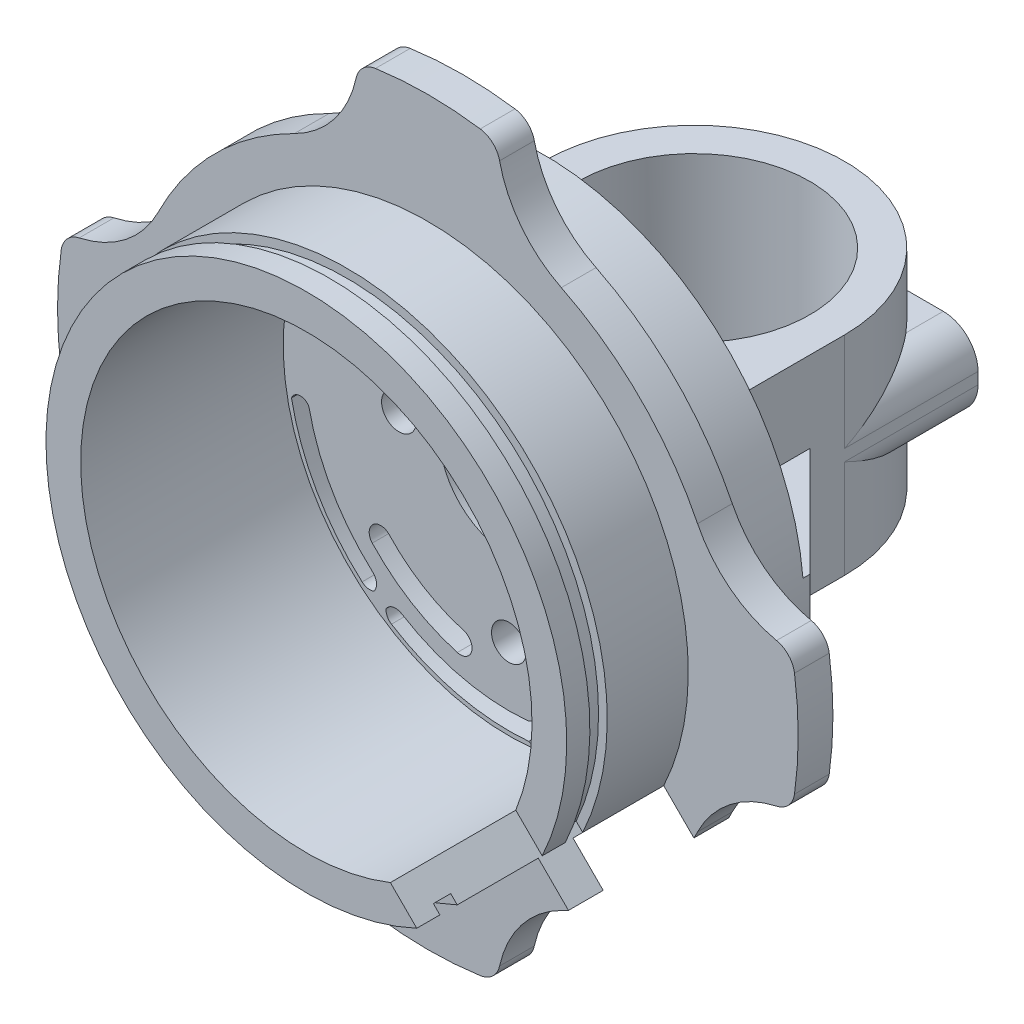
from build123d import *

# Parameters (mm, degrees)
SKETCH_1_R           = 18
EXTRUDE_1_DEPTH      = 3
SKETCH_2_W           = 26
SKETCH_2_H           = 18
EXTRUDE_2_DEPTH      = 13
EXTRUDE_3_DEPTH      = 9
SKETCH_6_R           = 10
CUT_EXTRUDE_1_DEPTH  = 42.581245773
SKETCH_7_R           = 1.5
CUT_EXTRUDE_2_DEPTH  = 39.587562763
EXTRUDE_4_DEPTH      = 3.5
SKETCH_9_R           = 1.5
CUT_EXTRUDE_3_DEPTH  = 38.497226678
FILLET_1_R           = 3
SKETCH_10_R          = 6
CUT_EXTRUDE_4_DEPTH  = 10
EXTRUDE_START        = -3
SKETCH_12_R          = 26
SKETCH_12_R_2        = 18
EXTRUDE_5_DEPTH      = 3
SKETCH_13_R          = 22.5
SKETCH_13_R_2        = 19.5
EXTRUDE_6_DEPTH      = 17.5
CUT_EXTRUDE_START    = -1.5
SKETCH_21_R          = 22.5
SKETCH_21_R_2        = 21.75
CUT_EXTRUDE_7_DEPTH  = 1.5
CUT_EXTRUDE_8_REACH  = 61.281
CUT_EXTRUDE_11_DEPTH = 3
SKETCH_28_W          = 10
SKETCH_28_H          = 4
EXTRUDE_10_DEPTH     = 10
CUT_EXTRUDE_13_DEPTH = 10
CUT_EXTRUDE_16_DEPTH = 10
CUT_EXTRUDE_17_DEPTH = 10
FILLET_4_R           = 1
FILLET_5_R           = 1
FILLET_6_R           = 1
FILLET_7_R           = 1
CUT_EXTRUDE_START_2  = -10
SKETCH_35_R          = 26
SKETCH_35_R_2        = 22.5
CUT_EXTRUDE_18_DEPTH = 10
SKETCH_36_R          = 26
SKETCH_36_R_2        = 22.5
EXTRUDE_11_DEPTH     = 3
CUT_EXTRUDE_19_DEPTH = 3
EXTRUDE_12_DEPTH     = 3
FILLET_8_R           = 10
FILLET_9_R           = 2
EXTRUDE_13_DEPTH     = 3
FILLET_10_R          = 10
FILLET_11_R          = 2


with BuildPart() as part:
    # 草图1 → 凸台-拉伸1 (new body)
    with BuildSketch(Plane.XY):
        Circle(SKETCH_1_R)
    extrude(amount=EXTRUDE_1_DEPTH)

    # 草图2 → 凸台-拉伸2 (add)
    with BuildSketch(Plane(origin=(0, 0, 0), x_dir=(-1, 0, 0), z_dir=(0, 0, -1))):
        Rectangle(SKETCH_2_W, SKETCH_2_H)
    extrude(amount=EXTRUDE_2_DEPTH)

    # 草图5 → 凸台-拉伸3 (add, symmetric)
    with BuildSketch(Plane(origin=(0, 0, 0), x_dir=(1, 0, 0), z_dir=(0, 1, 0))):
        with BuildLine():
            Line((-13, 13), (13, 13))
            ThreePointArc((13, 13), (0, 26), (-13, 13))
        make_face()
    extrude(amount=EXTRUDE_3_DEPTH, both=True)

    # 草图6 → 切除-拉伸1 (cut, through all)
    with BuildSketch(Plane(origin=(0, 9, 0), x_dir=(1, 0, 0), z_dir=(0, 1, 0))):
        with Locations(Location((0, 13, 0), (0, 0, 180))):
            Circle(SKETCH_6_R)
    extrude(amount=-CUT_EXTRUDE_1_DEPTH, mode=Mode.SUBTRACT)

    # 草图7 → 切除-拉伸2 (cut, through all)
    with BuildSketch(Plane.XY.offset(3)):
        with Locations((-9.5, 0)):
            Circle(SKETCH_7_R)
        with Locations((9.5, 0)):
            Circle(SKETCH_7_R)
        with Locations((0, 12.5)):
            Circle(SKETCH_7_R)
        with Locations((0, -12.5)):
            Circle(SKETCH_7_R)
    extrude(amount=-CUT_EXTRUDE_2_DEPTH, mode=Mode.SUBTRACT)

    # 草图8 → 凸台-拉伸4 (add, symmetric)
    with BuildSketch(Plane(origin=(0, 0, 0), x_dir=(1, 0, 0), z_dir=(0, 1, 0))):
        with BuildLine():
            Line((-6, 24.532562595), (-13, 24.532562595))
            Line((-13, 24.532562595), (-13, 13))
            ThreePointArc((-13, 13), (-11.113055385, 19.745368782), (-6, 24.532562595))
        make_face()
        with BuildLine():
            Line((6, 24.532562595), (13, 24.532562595))
            Line((13, 24.532562595), (13, 13))
            ThreePointArc((13, 13), (11.113055385, 19.745368782), (6, 24.532562595))
        make_face()
    extrude(amount=EXTRUDE_4_DEPTH, both=True)

    # 草图9 → 切除-拉伸3 (cut, through all)
    with BuildSketch(Plane(origin=(0, 0, -24.532562595), x_dir=(-1, 0, 0), z_dir=(0, 0, -1))):
        with Locations(Location((9.5, 0, 0), (0, 0, 180))):
            Circle(SKETCH_9_R)
        with Locations((-9.5, 0)):
            Circle(SKETCH_9_R)
    extrude(amount=-CUT_EXTRUDE_3_DEPTH, mode=Mode.SUBTRACT)

    # 圆角1
    fillet_1_edges = [part.edges().sort_by_distance(p)[0] for p in [
        (-13, -3.5, -18.766281297),
        (-13, 3.5, -18.766281297),
        (13, -3.5, -18.766281297),
        (13, 3.5, -18.766281297),
    ]]
    fillet(fillet_1_edges, radius=FILLET_1_R)

    # 草图10 → 切除-拉伸4 (cut)
    with BuildSketch(Plane.XY.offset(3)):
        Circle(SKETCH_10_R)
    extrude(amount=-CUT_EXTRUDE_4_DEPTH, mode=Mode.SUBTRACT)

    # 草图12 → 凸台-拉伸5 (add)
    with BuildSketch(Plane.XY.offset(3).offset(EXTRUDE_START)):
        Circle(SKETCH_12_R)
        Circle(SKETCH_12_R_2, mode=Mode.SUBTRACT)
    extrude(amount=EXTRUDE_5_DEPTH)

    # 草图13 → 凸台-拉伸6 (add)
    with BuildSketch(Plane.XY.offset(3)):
        Circle(SKETCH_13_R)
        Circle(SKETCH_13_R_2, mode=Mode.SUBTRACT)
    extrude(amount=EXTRUDE_6_DEPTH)

    # 草图21 → 切除-拉伸7 (cut)
    with BuildSketch(Plane.XY.offset(18.5).offset(CUT_EXTRUDE_START)):
        Circle(SKETCH_21_R)
        Circle(SKETCH_21_R_2, mode=Mode.SUBTRACT)
    extrude(amount=CUT_EXTRUDE_7_DEPTH, mode=Mode.SUBTRACT)

    # 切除-拉伸8: up to this face of the body (flat: up to its plane)
    cut_extrude_8_end = Plane(part.part.faces().sort_by_distance((-25.264608948, 0, 3))[0])
    # 草图22 → 切除-拉伸8 (cut, up to the picked face)
    with BuildSketch(Plane.XY.offset(20.5), mode=Mode.PRIVATE) as cut_extrude_8_sk1:
        Polygon((10.837782175, 0), (0, -10.837782175), (13.87016041, -24.707942585), (24.707942585, -13.87016041), align=None)
    cut_extrude_8_tool1 = split(extrude(cut_extrude_8_sk1.sketch, amount=-CUT_EXTRUDE_8_REACH, mode=Mode.PRIVATE), bisect_by=cut_extrude_8_end, keep=Keep.BOTH, mode=Mode.PRIVATE)
    add(cut_extrude_8_tool1.solids().sort_by(Axis((12.353971, -12.353971, 20.5), (0, 0, -1)))[0], mode=Mode.SUBTRACT)

    # 草图25 → 切除-拉伸11 (cut)
    with BuildSketch(Plane.XY.offset(3)):
        Polygon((7.260250026, -18.098032201), (5.581108912, -16.418891088), (13, -9), (16.418891088, -5.581108912), (18.098032201, -7.260250026), (25.296219368, -14.458437193), (14.458437193, -25.296219368), align=None)
    extrude(amount=-CUT_EXTRUDE_11_DEPTH, mode=Mode.SUBTRACT)

    # 草图28 → 凸台-拉伸10 (add)
    with BuildSketch(Plane(origin=(13, 0, 0), x_dir=(0, 0, -1), z_dir=(1, 0, 0))):
        with Locations((5, 0)):
            Rectangle(SKETCH_28_W, SKETCH_28_H)
    extrude_10 = extrude(amount=EXTRUDE_10_DEPTH)

    # 草图29 → 切除-拉伸13 (cut)
    with BuildSketch(Plane(origin=(0, 2, 0), x_dir=(1, 0, 0), z_dir=(0, 1, 0))):
        Polygon((13, 10), (23, 0), (23, 10), align=None)
    cut_extrude_13 = extrude(amount=-CUT_EXTRUDE_13_DEPTH, mode=Mode.SUBTRACT)

    # 镜向1: 凸台-拉伸10, 切除-拉伸13 across plane
    add(extrude_10.mirror(Plane(origin=(0, 0, 0), x_dir=(0, 0, 1), z_dir=(1, 0, 0))))
    add(cut_extrude_13.mirror(Plane(origin=(0, 0, 0), x_dir=(0, 0, 1), z_dir=(1, 0, 0))), mode=Mode.SUBTRACT)

    # 草图32 → 切除-拉伸16 (cut)
    with BuildSketch(Plane.XY.offset(3)):
        with BuildLine():
            Line((-1.25, 18.989775966), (-1.25, 17.486251029))
            ThreePointArc((-1.25, 17.486251029), (-11.274787606, 13.42425564), (-17.007444047, 4.251861012))
            ThreePointArc((-17.007444047, 4.251861012), (-18.038220453, 3.221084605), (-18.462657797, 4.615664449))
            ThreePointArc((-18.462657797, 4.615664449), (-12.198401118, 14.60729617), (-1.25, 18.989775966))
        make_face()
        with BuildLine():
            Line((1.25, 18.989775966), (1.25, 17.486251029))
            ThreePointArc((1.25, 17.486251029), (11.274787606, 13.42425564), (17.007444047, 4.251861012))
            ThreePointArc((17.007444047, 4.251861012), (17.607920176, 3.225791698), (18.646879703, 3.803678295))
            ThreePointArc((18.646879703, 3.803678295), (12.515024814, 14.33695383), (1.25, 18.989775966))
        make_face()
        with BuildLine():
            Line((-1.25, 16.097976574), (-1.25, 14.70939845))
            ThreePointArc((-1.25, 14.70939845), (-6.77507873, 13.115914416), (-11.272195471, 9.532392775))
            ThreePointArc((-11.272195471, 9.532392775), (-12.24744081, 9.450836993), (-12.328996592, 10.426082332))
            ThreePointArc((-12.328996592, 10.426082332), (-7.357980918, 14.372455134), (-1.25, 16.097976574))
        make_face()
        with BuildLine():
            Line((1.25, 16.097976574), (1.25, 14.70939845))
            ThreePointArc((1.25, 14.70939845), (6.77507873, 13.115914416), (11.272195471, 9.532392775))
            ThreePointArc((11.272195471, 9.532392775), (12.24744081, 9.450836993), (12.328996592, 10.426082332))
            ThreePointArc((12.328996592, 10.426082332), (7.357980918, 14.372455134), (1.25, 16.097976574))
        make_face()
    extrude(amount=-CUT_EXTRUDE_16_DEPTH, mode=Mode.SUBTRACT)

    # 草图33 → 切除-拉伸17 (cut)
    with BuildSketch(Plane.XY.offset(3)):
        with BuildLine():
            Line((-11.98073249, -14.910579423), (-11.041192675, -13.741278377))
            ThreePointArc((-11.041192675, -13.741278377), (-15.049297178, -9.178742918), (-17.271151749, -3.526752667))
            ThreePointArc((-17.271151749, -3.526752667), (-18.052998243, -3.069370633), (-18.785224063, -3.602594427))
            ThreePointArc((-18.785224063, -3.602594427), (-16.389132125, -9.862032138), (-11.98073249, -14.910579423))
        make_face()
        with BuildLine():
            Line((-10.911438585, -15.709991652), (-10.05575376, -14.47799998))
            ThreePointArc((-10.05575376, -14.47799998), (-4.443733677, -17.058250148), (1.713901598, -17.544036264))
            ThreePointArc((1.713901598, -17.544036264), (3.12617653, -18.28801874), (1.723398633, -19.049756609))
            ThreePointArc((1.723398633, -19.049756609), (-4.888100555, -18.492425549), (-10.911438585, -15.709991652))
        make_face()
        with BuildLine():
            ThreePointArc((-11.80268205, -10.978090683), (-8.437176399, -13.734476074), (-4.457143503, -15.490501942))
            ThreePointArc((-4.457143503, -15.490501942), (-3.219618835, -14.80600746), (-3.904113317, -13.568482792))
            ThreePointArc((-3.904113317, -13.568482792), (-7.390314608, -12.030339815), (-10.338237514, -9.615959191))
            ThreePointArc((-10.338237514, -9.615959191), (-11.751525528, -9.564802669), (-11.80268205, -10.978090683))
        make_face()
    extrude(amount=-CUT_EXTRUDE_17_DEPTH, mode=Mode.SUBTRACT)

    # 圆角4
    fillet_4_edges = [part.edges().sort_by_distance(p)[0] for p in [
        (-1.25, 17.486251029, 1.5),
        (1.25, 14.70939845, 1.5),
        (-1.25, 14.70939845, 1.5),
        (1.25, 17.486251029, 1.5),
        (-10.05575376, -14.47799998, 1.5),
        (-11.041192675, -13.741278377, 1.5),
    ]]
    fillet(fillet_4_edges, radius=FILLET_4_R)

    # 圆角5
    # the kernel refuses this fillet: 1 mm, written as the material it adds along each edge
    with BuildSketch(Plane(origin=(-1.25, 18.989775966, 3), x_dir=(0, -1, 0), z_dir=(0, 0, -1))) as fillet_5_piece_1:
        with BuildLine():
            CenterArc((1.08428672, 0.872687448), FILLET_5_R, 173.239166307, 67.533289918)
            Line((0.091240506, 0.990412616), (0.071379581, 0.99276712))
            ThreePointArc((0.071379581, 0.99276712), (0.019233264, 0.497637176), (-0.019956811, 0.001313655))
            Line((-0.019956811, 0.001313655), (0, -0.02))
            ThreePointArc((0, -0.02), (0.298003739, -0.02), (0.586241893, -0.017453749))
            Line((0.586241893, -0.017453749), (0.596007478, 0))
        make_face()
    extrude(amount=3)
    with BuildSketch(Plane(origin=(1.25, 18.989775966, 3), x_dir=(0, -1, 0), z_dir=(0, 0, -1))) as fillet_5_piece_2:
        with BuildLine():
            CenterArc((1.08428672, -0.872687448), FILLET_5_R, 119.227543774, 67.533289918)
            Line((0.091240506, -0.990412616), (0.071379581, -0.99276712))
            ThreePointArc((0.071379581, -0.99276712), (0.019233264, -0.497637176), (-0.019956811, -0.001313655))
            Line((-0.019956811, -0.001313655), (0, 0.02))
            ThreePointArc((0, 0.02), (0.298003739, 0.02), (0.586241893, 0.017453749))
            Line((0.586241893, 0.017453749), (0.596007478, 0))
        make_face()
    extrude(amount=3)
    with BuildSketch(Plane(origin=(1.25, 16.097976574, 3), x_dir=(1.2201884497529917e-12, -1.0, 0), z_dir=(0, 0, -1))) as fillet_5_piece_3:
        with BuildLine():
            CenterArc((1.091472558, -0.804097816), FILLET_5_R, 126.476783843, 61.317453805)
            Line((0.100711074, -0.939713746), (0.080895844, -0.942426065))
            ThreePointArc((0.080895844, -0.942426065), (0.02359244, -0.47272513), (-0.019939977, -0.001548329))
            Line((-0.019939977, -0.001548329), (0, 0.02))
            ThreePointArc((0, 0.02), (0.248487771, 0.02), (0.485085602, 0.016081956))
            Line((0.485085602, 0.016081956), (0.496975542, 0))
        make_face()
    extrude(amount=3)
    with BuildSketch(Plane(origin=(-1.25, 16.097976574, 3), x_dir=(-1.226443535178309e-12, -1.0, 0), z_dir=(0, 0, -1))) as fillet_5_piece_4:
        with BuildLine():
            CenterArc((1.091472558, 0.804097816), FILLET_5_R, 172.205762352, 61.317453805)
            Line((0.100711074, 0.939713746), (0.080895844, 0.942426065))
            ThreePointArc((0.080895844, 0.942426065), (0.02359244, 0.47272513), (-0.019939977, 0.001548329))
            Line((-0.019939977, 0.001548329), (0, -0.02))
            ThreePointArc((0, -0.02), (0.248487771, -0.02), (0.485085602, -0.016081956))
            Line((0.485085602, -0.016081956), (0.496975542, 0))
        make_face()
    extrude(amount=3)
    with BuildSketch(Plane(origin=(-10.911438585, -15.709991652, 3), x_dir=(0.570456550316079, 0.8213277812186063, 0), z_dir=(0, 0, -1))) as fillet_5_piece_5:
        with BuildLine():
            CenterArc((1.020863196, 0.869460839), FILLET_5_R, 177.250839457, 63.145206385)
            Line((0.022014106, 0.917424333), (0.002037125, 0.918383603))
            ThreePointArc((0.002037125, 0.918383603), (-0.014489926, 0.459323981), (-0.02, 0))
            Line((-0.02, 0), (0, -0.02))
            ThreePointArc((0, -0.02), (0.263430662, -0.02), (0.516981286, -0.017389217))
            Line((0.516981286, -0.017389217), (0.526861324, 0))
        make_face()
    extrude(amount=3)
    with BuildSketch(Plane(origin=(-11.98073249, -14.910579423, 3), x_dir=(0.6263598766364065, 0.7795340306490961, 0), z_dir=(0, 0, -1))) as fillet_5_piece_6:
        with BuildLine():
            CenterArc((1.020863196, -0.869460839), FILLET_5_R, 119.603954158, 63.145206385)
            Line((0.022014106, -0.917424333), (0.002037125, -0.918383603))
            ThreePointArc((0.002037125, -0.918383603), (-0.014489926, -0.459323981), (-0.02, 0))
            Line((-0.02, 0), (0, 0.02))
            ThreePointArc((0, 0.02), (0.263430662, 0.02), (0.516981286, 0.017389217))
            Line((0.516981286, 0.017389217), (0.526861324, 0))
        make_face()
    extrude(amount=3)

    # 圆角6
    fillet_6_edges = [part.edges().sort_by_distance(p)[0] for p in [
        (5.581108912, -16.418891088, 1.5),
        (16.418891088, -5.581108912, 1.5),
    ]]
    fillet(fillet_6_edges, radius=FILLET_6_R)

    # 圆角7
    fillet_7_edges = [part.edges().sort_by_distance(p)[0] for p in [
        (22.986919417, -12.149137242, 1.5),
        (12.149137242, -22.986919417, 1.5),
    ]]
    fillet(fillet_7_edges, radius=FILLET_7_R)

    # 草图35 → 切除-拉伸18 (cut)
    with BuildSketch(Plane.XY.offset(3).offset(CUT_EXTRUDE_START_2)):
        Circle(SKETCH_35_R)
        Circle(SKETCH_35_R_2, mode=Mode.SUBTRACT)
    extrude(amount=CUT_EXTRUDE_18_DEPTH, mode=Mode.SUBTRACT)

    # 草图36 → 凸台-拉伸11 (add)
    with BuildSketch(Plane.XY.offset(10).offset(EXTRUDE_START)):
        Circle(SKETCH_36_R)
        Circle(SKETCH_36_R_2, mode=Mode.SUBTRACT)
    extrude(amount=EXTRUDE_11_DEPTH)

    # 草图37 → 切除-拉伸19 (cut)
    with BuildSketch(Plane.XY.offset(10)):
        Polygon((9.539739177, -20.377521352), (20.377521352, -9.539739177), (25.796412439, -14.958630264), (13.566109332, -24.403891507), align=None)
    extrude(amount=-CUT_EXTRUDE_19_DEPTH, mode=Mode.SUBTRACT)

    # 草图38 → 凸台-拉伸12 (add)
    with BuildSketch(Plane.XY.offset(10).offset(EXTRUDE_START)):
        with BuildLine():
            Line((6, 25.298221281), (6, 31.432467291))
            ThreePointArc((6, 31.432467291), (0, 32), (-6, 31.432467291))
            Line((-6, 31.432467291), (-6, 25.298221281))
            ThreePointArc((-6, 25.298221281), (0, 26), (6, 25.298221281))
        make_face()
        with BuildLine():
            Line((6, -31.432467291), (6, -25.298221281))
            ThreePointArc((6, -25.298221281), (0, -26), (-6, -25.298221281))
            Line((-6, -25.298221281), (-6, -31.432467291))
            ThreePointArc((-6, -31.432467291), (0, -32), (6, -31.432467291))
        make_face()
    extrude(amount=EXTRUDE_12_DEPTH)

    # 圆角8
    # the kernel refuses this fillet: 10 mm, written as the material it adds along each edge
    with BuildSketch(Plane(origin=(-6, -25.298221281, 7), x_dir=(-0.9406786711057838, 0.33929874406878724, 0), z_dir=(0, 0, 1)), Plane(origin=(6, 25.298221281, 7), x_dir=(0.940678671105784, -0.33929874406878713, 0), z_dir=(0, 0, 1))) as fillet_8_piece_1:
        with BuildLine():
            CenterArc((7.009774086, 9.935880631), FILLET_8_R, 204.61713077, 58.891077489)
            Line((-2.081341967, 5.770354385), (-2.263164288, 5.68704386))
            ThreePointArc((-2.263164288, 5.68704386), (-1.228806718, 2.817317443), (-0.188135734, -0.067859749))
            Line((-0.188135734, -0.067859749), (0.022612174, -0.198717613))
            ThreePointArc((0.022612174, -0.198717613), (2.939582681, -0.033289641), (5.856553188, -0.198717613))
            Line((5.856553188, -0.198717613), (5.879165363, 0))
        make_face()
    extrude(amount=3)
    with BuildSketch(Plane(origin=(6, -25.298221281, 7), x_dir=(0.9406786711057841, 0.3392987440687868, 0), z_dir=(0, 0, 1)), Plane(origin=(-6, 25.298221281, 7), x_dir=(-0.9406786711057841, -0.339298744068787, 0), z_dir=(0, 0, 1))) as fillet_8_piece_2:
        with BuildLine():
            CenterArc((7.009774086, -9.935880631), FILLET_8_R, 96.491791741, 58.891077489)
            Line((-2.081341967, -5.770354385), (-2.263164288, -5.68704386))
            ThreePointArc((-2.263164288, -5.68704386), (-1.228806718, -2.817317443), (-0.188135734, 0.067859749))
            Line((-0.188135734, 0.067859749), (0.022612174, 0.198717613))
            ThreePointArc((0.022612174, 0.198717613), (2.939582681, 0.033289641), (5.856553188, 0.198717613))
            Line((5.856553188, 0.198717613), (5.879165363, 0))
        make_face()
    extrude(amount=3)

    # 圆角9
    fillet_9_edges = [part.edges().sort_by_distance(p)[0] for p in [
        (6, -31.432467291, 8.5),
        (-6, -31.432467291, 8.5),
        (-6, 31.432467291, 8.5),
        (6, 31.432467291, 8.5),
    ]]
    fillet(fillet_9_edges, radius=FILLET_9_R)

    # 草图39 → 凸台-拉伸13 (add)
    with BuildSketch(Plane.XY.offset(10).offset(EXTRUDE_START)):
        with BuildLine():
            Line((-25.298221281, 6), (-31.432467291, 6))
            ThreePointArc((-31.432467291, 6), (-32, 0), (-31.432467291, -6))
            Line((-31.432467291, -6), (-25.298221281, -6))
            ThreePointArc((-25.298221281, -6), (-26, 0), (-25.298221281, 6))
        make_face()
        with BuildLine():
            Line((31.432467291, -6), (25.298221281, -6))
            ThreePointArc((25.298221281, -6), (26, 0), (25.298221281, 6))
            Line((25.298221281, 6), (31.432467291, 6))
            ThreePointArc((31.432467291, 6), (32, 0), (31.432467291, -6))
        make_face()
    extrude(amount=EXTRUDE_13_DEPTH)

    # 圆角10
    # the kernel refuses this fillet: 10 mm, written as the material it adds along each edge
    with BuildSketch(Plane(origin=(-25.298221281, 6, 7), x_dir=(0.33929874406878485, 0.9406786711057847, 0), z_dir=(0, 0, 1)), Plane(origin=(25.298221281, -6, 7), x_dir=(-0.339298744068787, -0.940678671105784, 0), z_dir=(0, 0, 1))) as fillet_10_piece_1:
        with BuildLine():
            CenterArc((7.009774086, 9.935880631), FILLET_10_R, 204.61713077, 58.891077489)
            Line((-2.081341967, 5.770354385), (-2.263164288, 5.68704386))
            ThreePointArc((-2.263164288, 5.68704386), (-1.228806718, 2.817317443), (-0.188135734, -0.067859749))
            Line((-0.188135734, -0.067859749), (0.022612174, -0.198717613))
            ThreePointArc((0.022612174, -0.198717613), (2.939582681, -0.033289641), (5.856553188, -0.198717613))
            Line((5.856553188, -0.198717613), (5.879165363, 0))
        make_face()
    extrude(amount=3)
    with BuildSketch(Plane(origin=(-25.298221281, -6, 7), x_dir=(0.3392987440687862, -0.9406786711057843, 0), z_dir=(0, 0, 1)), Plane(origin=(25.298221281, 6, 7), x_dir=(-0.33929874406878524, 0.9406786711057846, 0), z_dir=(0, 0, 1))) as fillet_10_piece_2:
        with BuildLine():
            CenterArc((7.009774086, -9.935880631), FILLET_10_R, 96.491791741, 58.891077489)
            Line((-2.081341967, -5.770354385), (-2.263164288, -5.68704386))
            ThreePointArc((-2.263164288, -5.68704386), (-1.228806718, -2.817317443), (-0.188135734, 0.067859749))
            Line((-0.188135734, 0.067859749), (0.022612174, 0.198717613))
            ThreePointArc((0.022612174, 0.198717613), (2.939582681, 0.033289641), (5.856553188, 0.198717613))
            Line((5.856553188, 0.198717613), (5.879165363, 0))
        make_face()
    extrude(amount=3)

    # 圆角11
    fillet_11_edges = [part.edges().sort_by_distance(p)[0] for p in [
        (31.432467291, 6, 8.5),
        (31.432467291, -6, 8.5),
        (-31.432467291, -6, 8.5),
        (-31.432467291, 6, 8.5),
    ]]
    fillet(fillet_11_edges, radius=FILLET_11_R)


solid = part.part
